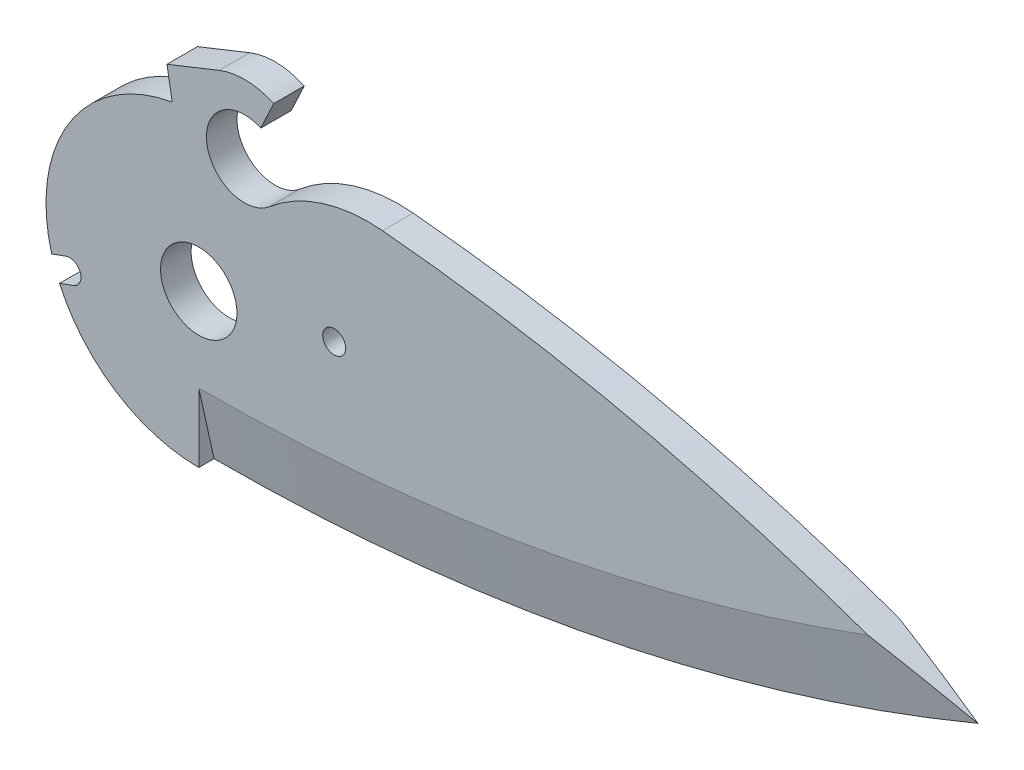
from build123d import *

# Parameters (mm, degrees)
SKICA1_R                      = 2.5
P_IDAT_VYSUNUT_M1_DEPTH       = 1
ODEBRAT_VYSUNUT_M1_DEPTH      = 52.800096525
ODEBRAT_VYSUNUT_M1_DEPTH_BACK = 52.800096525
SKICA4_R                      = 0.75


with BuildPart() as part:
    # Skica1 → Přidat vysunutím1 (new, symmetric)
    with BuildSketch(Plane.XY):
        with BuildLine():
            Line((1.333550617, 13.180065365), (-2.083778132, 11.817693036))
            Line((-2.083778132, 11.817693036), (-1.736481777, 9.84807753))
            ThreePointArc((-1.736481777, 9.84807753), (-7.660444431, 6.427876097), (-10, 0))
            ThreePointArc((-10, 0), (-7.071067812, -7.071067812), (0, -10))
            ThreePointArc((0, -10), (25.495097568, -7.47548784), (50, 0))
            ThreePointArc((50, 0), (31.373196339, 6.157530697), (12.031913616, 9.442006531))
            ThreePointArc((12.031913616, 9.442006531), (8.089430482, 9.018973617), (4.62127636, 7.096985821))
            ThreePointArc((4.62127636, 7.096985821), (0.522628014, 8.664398983), (4.056545654, 11.265769468))
            Line((4.056545654, 11.265769468), (4.901782178, 13.078385042))
            ThreePointArc((4.901782178, 13.078385042), (3.128179964, 13.498174063), (1.333550617, 13.180065365))
        make_face()
        Circle(SKICA1_R, mode=Mode.SUBTRACT)
    extrude(amount=P_IDAT_VYSUNUT_M1_DEPTH, both=True)

    # Skica4 → Odebrat vysunutím1 (cut, two sides: drawn at the far end of the back side and taken through both)
    with BuildSketch(Plane.XY.offset(-ODEBRAT_VYSUNUT_M1_DEPTH_BACK)):
        with Locations((8.863269777, 1.562833599)):
            Circle(SKICA4_R)
        with BuildLine():
            Line((-8.713748695, -2.373411824), (-9.62697519, -2.705799086))
            ThreePointArc((-9.62697519, -2.705799086), (-9.396926208, -3.420201433), (-9.113944975, -4.115338017))
            Line((-9.113944975, -4.115338017), (-8.20071848, -3.782950756))
            ThreePointArc((-8.20071848, -3.782950756), (-7.752464121, -2.821666182), (-8.713748695, -2.373411824))
        make_face()
    extrude(amount=ODEBRAT_VYSUNUT_M1_DEPTH + ODEBRAT_VYSUNUT_M1_DEPTH_BACK, mode=Mode.SUBTRACT)

    # Odebrat tažením po křivce1: sweep along a path in Skica3
    with BuildLine(Plane.XY) as odebrat_ta_en_m_po_k_ivce1_path:
        ThreePointArc((0, -10), (25.495097568, -7.47548784), (50, 0))
    # Skica2 → Odebrat tažením po křivce1 (sweep, cut)
    with BuildSketch(Plane(origin=(0, 0, 0), x_dir=(0, 0, -1), z_dir=(1, 0, 0))):
        Polygon((0, -10), (-1, -5.489291496), (-1, -10), align=None)
    odebrat_ta_en_m_po_k_ivce1 = sweep(path=odebrat_ta_en_m_po_k_ivce1_path.line, mode=Mode.SUBTRACT)

    # Zrcadlit1: Odebrat tažením po křivce1 across plane
    add(odebrat_ta_en_m_po_k_ivce1.mirror(Plane.XY), mode=Mode.SUBTRACT)


solid = part.part
